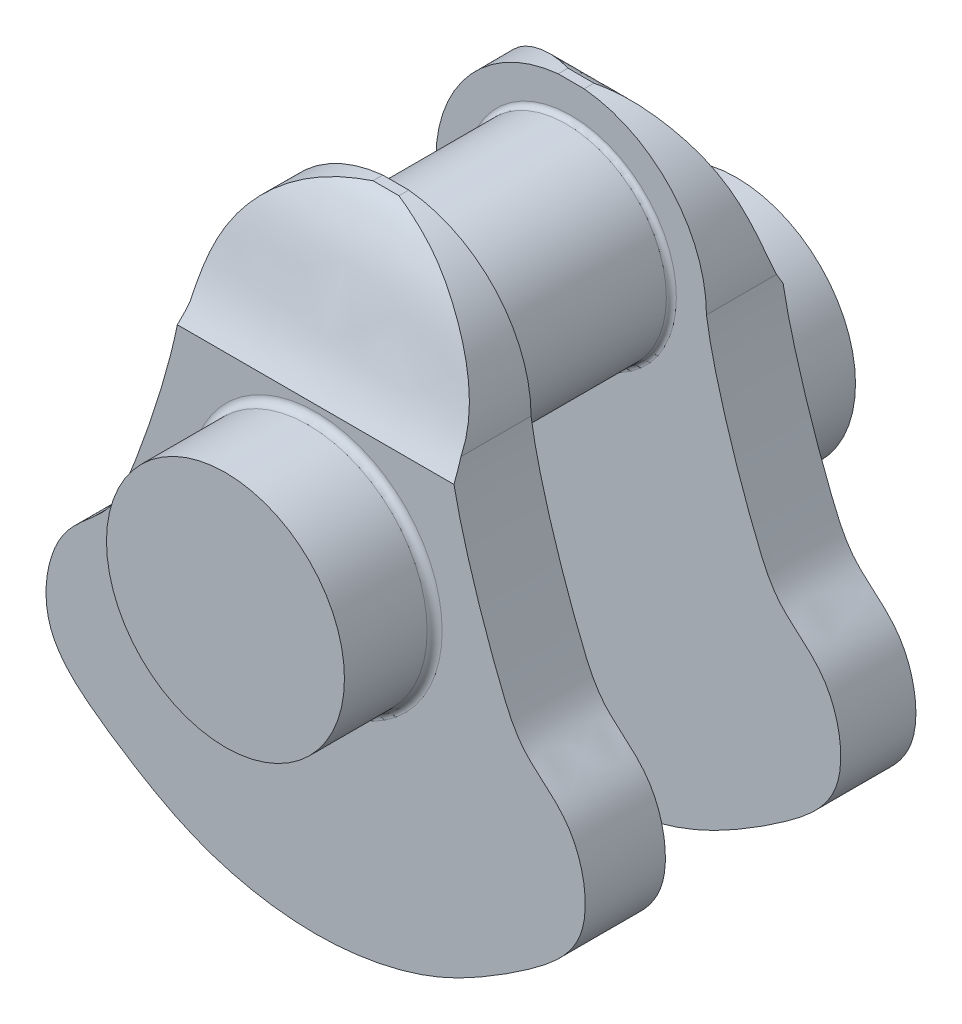
from build123d import *

# Parameters (mm, degrees)
SKETCH_1_R          = 47.5
EXTRUDE_1_DEPTH     = 36
EXTRUDE_START       = -68
EXTRUDE_2_DEPTH     = 32
SKETCH_3_R          = 40
EXTRUDE_3_DEPTH     = 70
EXTRUDE_START_2     = 30
EXTRUDE_4_DEPTH     = 30
SKETCH_6_R          = 47.5
EXTRUDE_5_DEPTH     = 36
CUT_EXTRUDE_1_DEPTH = 265.760999654
FILLET_1_R          = 2
FILLET_2_R          = 3


# Read off the part's stored shape, not the designer's step: Бобышка-Вытянуть2
with BuildPart() as part:
    # Эскиз1 → Бобышка-Вытянуть1 (new body)
    with BuildSketch(Plane.XY):
        Circle(SKETCH_1_R)
    extrude(amount=-EXTRUDE_1_DEPTH)

    # Бобышка-Вытянуть2 outline → Бобышка-Вытянуть2 (add)
    with BuildSketch(Plane.XY.offset(EXTRUDE_START)):
        with BuildLine():
            add(Edge.make_bspline(
                [(0, -130), (-15.880354868, -130.01187586), (-41.633386716, -125.290250767), (-68.14378294, -111.004181912), (-90.278376052, -96.565429944), (-111.635936159, -78.175364448), (-104.918293897, -40.337311808), (-82.533429777, -27.443039559), (-67.806297481, 5.97284584), (-56.49953787, 42.419936068), (-54, 60)],
                knots=[0, 0, 0, 0, 0.181438181, 0.280272946, 0.34887985, 0.450421733, 0.560059401, 0.653196428, 0.728064428, 1, 1, 1, 1], degree=3))
            add(Edge.make_bspline(
                [(54, 60), (56.49953787, 42.419936068), (67.806297481, 5.97284584), (82.533429777, -27.443039559), (104.918293897, -40.337311808), (111.635936159, -78.175364448), (90.278376052, -96.565429944), (68.14378294, -111.004181912), (41.633386716, -125.290250767), (15.880354868, -130.01187586), (0, -130)],
                knots=[0, 0, 0, 0, 0.271935572, 0.346803572, 0.439940599, 0.549578267, 0.65112015, 0.719727054, 0.818561819, 1, 1, 1, 1], degree=3))
            ThreePointArc((54, 60), (0, 114), (-54, 60))
        make_face()
    extrude(amount=EXTRUDE_2_DEPTH)

    # Эскиз3 → Бобышка-Вытянуть3 (add)
    with BuildSketch(Plane(origin=(0, 0, -68), x_dir=(-1, 0, 0), z_dir=(0, 0, -1))):
        with Locations(Location((0, 60, 0), (0, 0, 180))):
            Circle(SKETCH_3_R)
    extrude(amount=EXTRUDE_3_DEPTH)

    # Эскиз4 → Бобышка-Вытянуть4 (add)
    with BuildSketch(Plane(origin=(0, 0, -138), x_dir=(-1, 0, 0), z_dir=(0, 0, -1)).offset(EXTRUDE_START_2)):
        with BuildLine():
            ThreePointArc((-54, 60), (0, 114), (54, 60))
            add(Edge.make_bspline(
                [(0, -130), (15.880354868, -130.01187586), (41.633386716, -125.290250767), (68.14378294, -111.004181912), (90.278376052, -96.565429944), (111.635936159, -78.175364448), (104.918293897, -40.337311808), (82.533429777, -27.443039559), (67.806297481, 5.97284584), (56.49953787, 42.419936068), (54, 60)],
                knots=[0, 0, 0, 0, 0.181438181, 0.280272946, 0.34887985, 0.450421733, 0.560059401, 0.653196428, 0.728064428, 1, 1, 1, 1], degree=3))
            add(Edge.make_bspline(
                [(0, -130), (-15.880354868, -130.01187586), (-41.633386716, -125.290250767), (-68.14378294, -111.004181912), (-90.278376052, -96.565429944), (-111.635936159, -78.175364448), (-104.918293897, -40.337311808), (-82.533429777, -27.443039559), (-67.806297481, 5.97284584), (-56.49953787, 42.419936068), (-54, 60)],
                knots=[0, 0, 0, 0, 0.181438181, 0.280272946, 0.34887985, 0.450421733, 0.560059401, 0.653196428, 0.728064428, 1, 1, 1, 1], degree=3))
        make_face()
    extrude(amount=-EXTRUDE_4_DEPTH)

    # Эскиз6 → Бобышка-Вытянуть5 (add)
    with BuildSketch(Plane(origin=(0, 0, -168), x_dir=(-1, 0, 0), z_dir=(0, 0, -1))):
        with Locations(Location((0, 0, 0), (0, 0, 180))):
            Circle(SKETCH_6_R)
    extrude(amount=EXTRUDE_5_DEPTH)

    # Эскиз7 → Вырез-Вытянуть1 (cut, symmetric)
    with BuildSketch(Plane(origin=(0, 0, 0), x_dir=(0, 0, -1), z_dir=(1, 0, 0))):
        with BuildLine():
            Line((27.513510499, 53), (36, 53))
            add(Edge.make_bspline(
                [(64.081537648, 113.750924011), (63.323416805, 113.54507352), (60.654990831, 112.300721999), (46.719773174, 93.014787457), (47.282891804, 69.534512643), (36, 53)],
                knots=[0.022408642, 0.022408642, 0.022408642, 0.022408642, 0.055874476, 0.151831307, 1, 1, 1, 1], degree=3))
            Line((64.081537648, 113.750924011), (68, 113.750924011))
            Line((68, 113.750924011), (68, 121.36125898))
            Line((68, 121.36125898), (27.513510499, 121.36125898))
            Line((27.513510499, 121.36125898), (27.513510499, 53))
        make_face()
        with BuildLine():
            Line((178.486489501, 53), (178.486489501, 121.36125898))
            Line((178.486489501, 121.36125898), (138, 121.36125898))
            Line((138, 121.36125898), (138, 113.750924011))
            Line((138, 113.750924011), (141.918462352, 113.750924011))
            add(Edge.make_bspline(
                [(141.918462352, 113.750924011), (142.676583195, 113.54507352), (145.345009169, 112.300721999), (159.280226826, 93.014787457), (158.717108196, 69.534512643), (170, 53)],
                knots=[0.022408642, 0.022408642, 0.022408642, 0.022408642, 0.055874476, 0.151831307, 1, 1, 1, 1], degree=3))
            Line((170, 53), (178.486489501, 53))
        make_face()
    extrude(amount=CUT_EXTRUDE_1_DEPTH, both=True, mode=Mode.SUBTRACT)

    # Скругление1
    fillet_1_edges = [part.edges().sort_by_distance(p)[0] for p in [
        (-40, 60, -68),
        (-40, 60, -138),
    ]]
    fillet(fillet_1_edges, radius=FILLET_1_R)

    # Скругление2
    fillet_2_edges = [part.edges().sort_by_distance(p)[0] for p in [
        (-47.5, 0, -168),
        (-47.5, 0, -36),
    ]]
    fillet(fillet_2_edges, radius=FILLET_2_R)


solid = part.part
